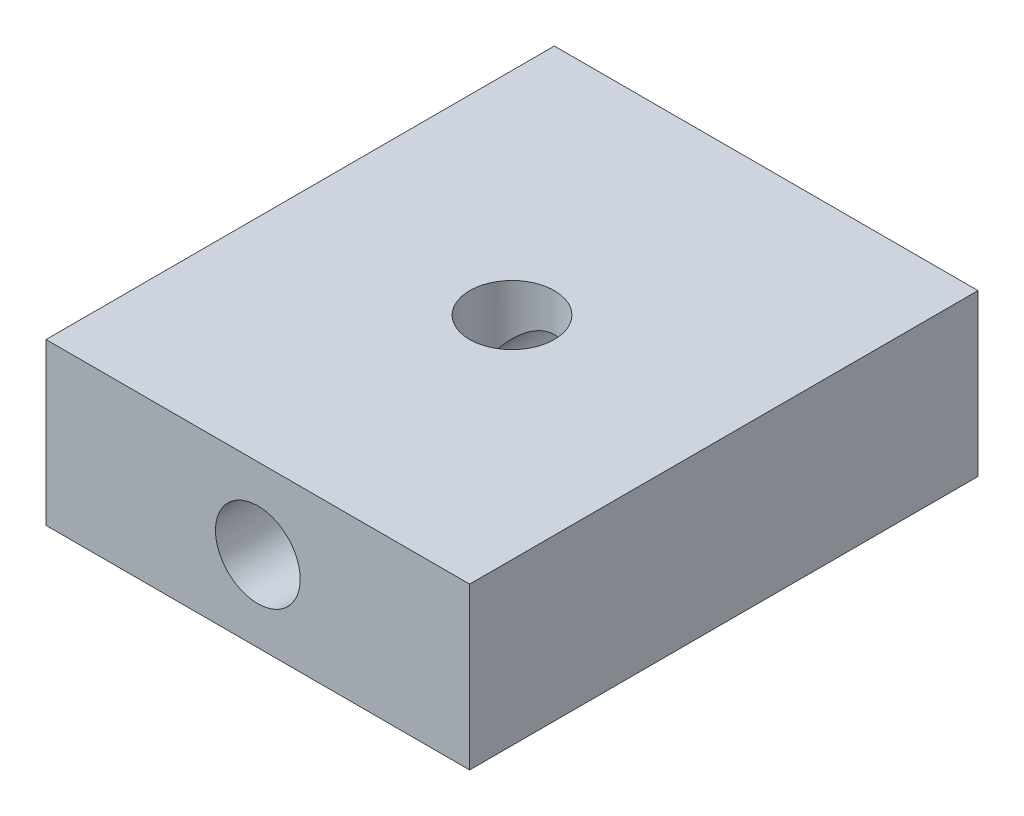
from build123d import *

# Parameters (mm, degrees)
SKETCH1_W           = 50
SKETCH1_H           = 60
BOSS_EXTRUDE1_DEPTH = 19
SKETCH2_R           = 5
CUT_EXTRUDE1_DEPTH  = 68.720011813
SKETCH3_R           = 5
CUT_EXTRUDE2_DEPTH  = 9


with BuildPart() as part:
    # Sketch1 → Boss-Extrude1 (new body)
    with BuildSketch(Plane(origin=(0, 0, 0), x_dir=(1, 0, 0), z_dir=(0, 1, 0))):
        Rectangle(SKETCH1_W, SKETCH1_H)
    extrude(amount=BOSS_EXTRUDE1_DEPTH)

    # Sketch2 → Cut-Extrude1 (cut, through all)
    with BuildSketch(Plane.XY.offset(30)):
        with Locations((0, 9.5)):
            Circle(SKETCH2_R)
    extrude(amount=-CUT_EXTRUDE1_DEPTH, mode=Mode.SUBTRACT)

    # Sketch3 → Cut-Extrude2 (cut)
    with BuildSketch(Plane(origin=(0, 19, 0), x_dir=(1, 0, 0), z_dir=(0, 1, 0))):
        Circle(SKETCH3_R)
    extrude(amount=-CUT_EXTRUDE2_DEPTH, mode=Mode.SUBTRACT)


solid = part.part
